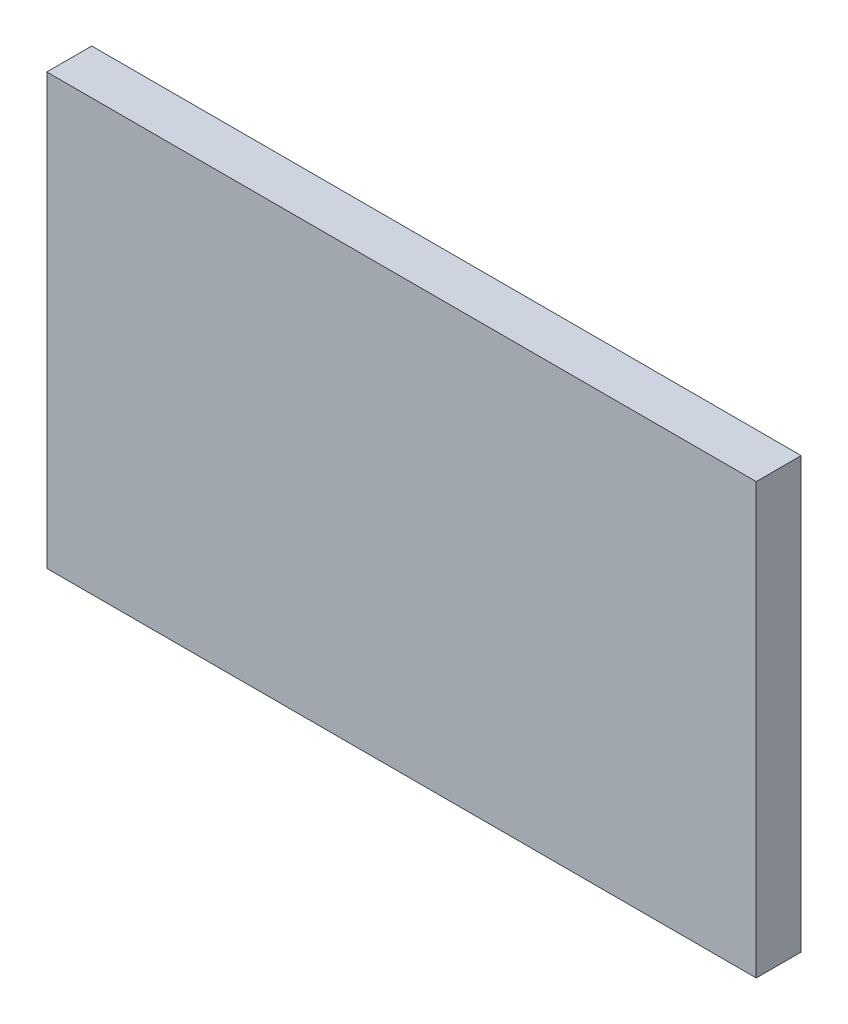
from build123d import *

# Parameters (mm, degrees)
SKETCH1_W           = 292.556955844
SKETCH1_H           = 177.286243871
BOSS_EXTRUDE1_DEPTH = 18.542


with BuildPart() as part:
    # Sketch1 → Boss-Extrude1 (new body)
    with BuildSketch(Plane.XY):
        with Locations((4.274127411, 5.90566029)):
            Rectangle(SKETCH1_W, SKETCH1_H)
    extrude(amount=-BOSS_EXTRUDE1_DEPTH)


solid = part.part
